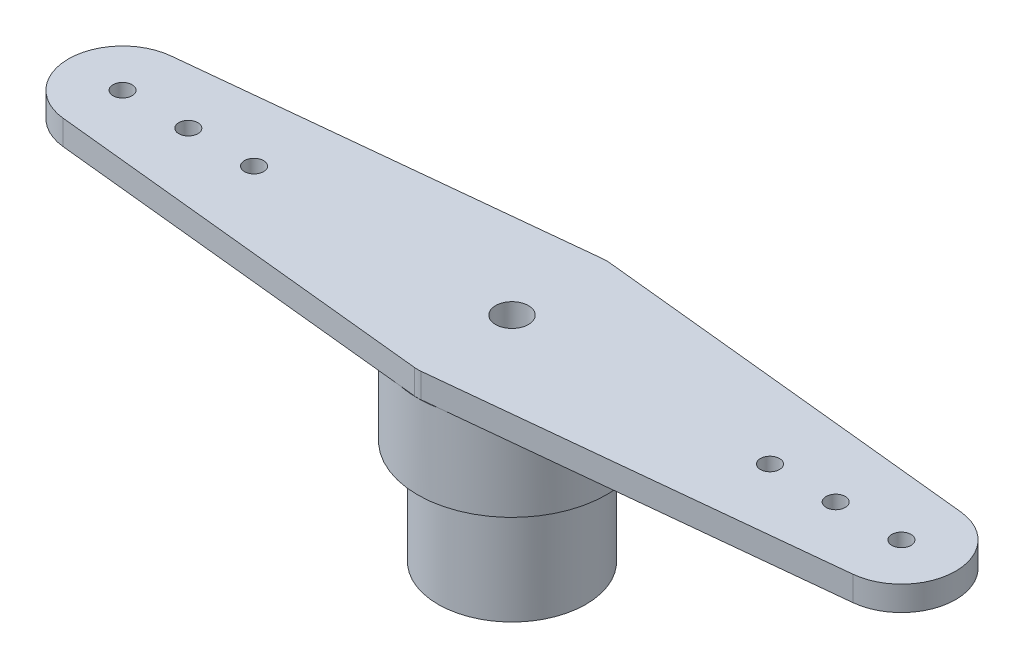
from build123d import *

# Parameters (mm, degrees)
SKETCH1_R           = 2.875
BOSS_EXTRUDE1_DEPTH = 2.55
BOSS_EXTRUDE2_START = 0.75
SKETCH1_4_R         = 0.291434634
BOSS_EXTRUDE2_DEPTH = 0.75
SKETCH2_R           = 2.25
BOSS_EXTRUDE3_DEPTH = 3.2
SKETCH3_R           = 0.5
CUT_EXTRUDE1_DEPTH  = 16.256658382
FILLET1_R           = 1


with BuildPart() as part:
    # Sketch1 → Boss-Extrude1 (new body)
    with BuildSketch(Plane(origin=(0, 0, 0), x_dir=(1, 0, 0), z_dir=(0, 1, 0))):
        with Locations(Location((0, 0, 0), (0, 0, 270))):
            Circle(SKETCH1_R)
    extrude(amount=-BOSS_EXTRUDE1_DEPTH)

    # Sketch1<4> → Boss-Extrude2 (add)
    # profile 1 of 3: a face of its own
    with BuildSketch(Plane(origin=(0, 0, 0), x_dir=(1, 0, 0), z_dir=(0, 1, 0)).offset(BOSS_EXTRUDE2_START)):
        with BuildLine():
            Line((-0.584049273, 2.815050878), (-12.018477316, 1.641376067))
            ThreePointArc((-12.018477316, 1.641376067), (-13.5, 0), (-12.018477316, -1.641376067))
            Line((-12.018477316, -1.641376067), (-0.584049273, -2.815050878))
            ThreePointArc((-0.584049273, -2.815050878), (-2.875, 0), (-0.584049273, 2.815050878))
        make_face()
        with Locations(Location((-11.85, 0, 0), (0, 0, 270))):
            Circle(SKETCH1_4_R, mode=Mode.SUBTRACT)
        with Locations(Location((-9.85, 0, 0), (0, 0, 270))):
            Circle(SKETCH1_4_R, mode=Mode.SUBTRACT)
        with Locations(Location((-7.85, 0, 0), (0, 0, 270))):
            Circle(SKETCH1_4_R, mode=Mode.SUBTRACT)
    # profile 2 of 3: a face of its own
    with BuildSketch(Plane(origin=(0, 0, 0), x_dir=(1, 0, 0), z_dir=(0, 1, 0)).offset(BOSS_EXTRUDE2_START)):
        with BuildLine():
            Line((12.018477316, 1.641376067), (0.584049273, 2.815050878))
            ThreePointArc((0.584049273, 2.815050878), (2.229884152, 1.81472909), (2.875, 0))
            ThreePointArc((2.875, 0), (2.229884152, -1.81472909), (0.584049273, -2.815050878))
            Line((0.584049273, -2.815050878), (12.018477316, -1.641376067))
            ThreePointArc((12.018477316, -1.641376067), (13.5, 0), (12.018477316, 1.641376067))
        make_face()
        with Locations(Location((7.85, 0, 0), (0, 0, 270))):
            Circle(SKETCH1_4_R, mode=Mode.SUBTRACT)
        with Locations(Location((9.85, 0, 0), (0, 0, 270))):
            Circle(SKETCH1_4_R, mode=Mode.SUBTRACT)
        with Locations(Location((11.85, 0, 0), (0, 0, 270))):
            Circle(SKETCH1_4_R, mode=Mode.SUBTRACT)
    # profile 3 of 3: a face of its own
    with BuildSketch(Plane(origin=(0, 0, 0), x_dir=(1, 0, 0), z_dir=(0, 1, 0)).offset(BOSS_EXTRUDE2_START)):
        with BuildLine():
            Line((0, 2.875), (-0.584049273, 2.815050878))
            ThreePointArc((-0.584049273, 2.815050878), (-2.875, 0), (-0.584049273, -2.815050878))
            Line((-0.584049273, -2.815050878), (0, -2.875))
            Line((0, -2.875), (0.584049273, -2.815050878))
            ThreePointArc((0.584049273, -2.815050878), (2.229884152, -1.81472909), (2.875, 0))
            ThreePointArc((2.875, 0), (2.229884152, 1.81472909), (0.584049273, 2.815050878))
            Line((0.584049273, 2.815050878), (0, 2.875))
        make_face()
    extrude(amount=-BOSS_EXTRUDE2_DEPTH)

    # Sketch2 → Boss-Extrude3 (add)
    with BuildSketch(Plane.XZ.offset(2.55)):
        with Locations(Location((0, 0, 0), (0, 0, 90))):
            Circle(SKETCH2_R)
    extrude(amount=BOSS_EXTRUDE3_DEPTH)

    # Sketch3 → Cut-Extrude1 (cut, through all)
    with BuildSketch(Plane.XZ.offset(5.75)):
        with Locations(Location((0, 0, 0), (0, 0, 270))):
            Circle(SKETCH3_R)
    extrude(amount=-CUT_EXTRUDE1_DEPTH, mode=Mode.SUBTRACT)

    # Fillet1
    # the kernel refuses this fillet: 1 mm, written as the material it takes off along each edge
    with BuildSketch(Plane(origin=(0, 1.006609864, -2.875), x_dir=(0.9947733740707481, 0, 0.10210746417328842), z_dir=(0, -1, 0))) as fillet1_piece_1:
        with BuildLine():
            CenterArc((FILLET1_R * 0.102643945681, FILLET1_R), FILLET1_R, 258.278918799, 11.721081201)
            Line((-FILLET1_R * 0.100503627626, FILLET1_R * 0.0208518684798), (0, 0))
            Line((0, 0), (FILLET1_R * 0.102643945681, 0))
        make_face()
    extrude(amount=1.006609864, mode=Mode.SUBTRACT)
    with BuildSketch(Plane(origin=(0, 1.006609864, 2.875), x_dir=(0.9947733740707481, 0, -0.10210746417328823), z_dir=(0, -1, 0))) as fillet1_piece_2:
        with BuildLine():
            CenterArc((FILLET1_R * 0.102643945681, -FILLET1_R), FILLET1_R, 90, 11.721081201)
            Line((-FILLET1_R * 0.100503627626, -FILLET1_R * 0.0208518684798), (0, 0))
            Line((0, 0), (FILLET1_R * 0.102643945681, 0))
        make_face()
    extrude(amount=1.006609864, mode=Mode.SUBTRACT)


solid = part.part
